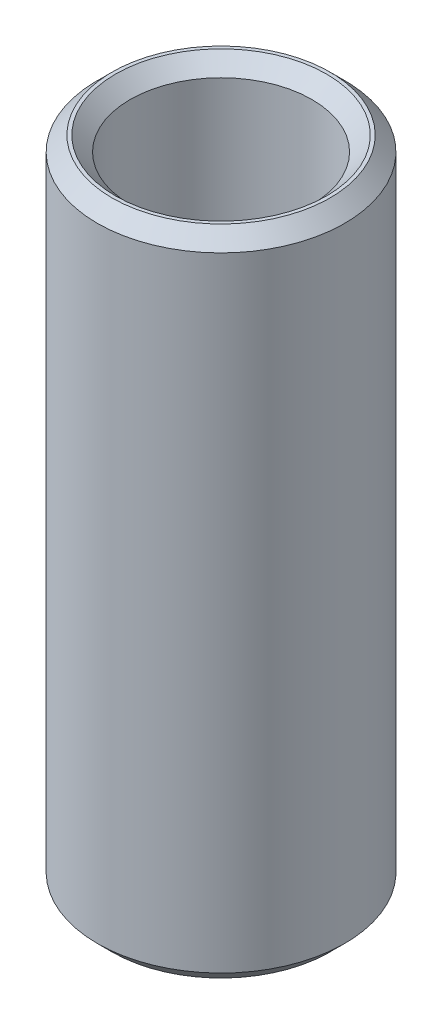
from build123d import *

# Parameters (mm, degrees)
SKETCH1_R           = 10
BOSS_EXTRUDE1_DEPTH = 52.796442174
SKETCH2_R           = 7.348332093
CUT_EXTRUDE1_DEPTH  = 55.657701253
CHAMFER1_SIZE       = 1.185703705


with BuildPart() as part:
    # Sketch1 → Boss-Extrude1 (new body)
    with BuildSketch(Plane(origin=(0, 0, 0), x_dir=(1, 0, 0), z_dir=(0, 1, 0))):
        Circle(SKETCH1_R)
    extrude(amount=BOSS_EXTRUDE1_DEPTH)

    # Sketch2 → Cut-Extrude1 (cut, through all)
    with BuildSketch(Plane(origin=(0, 0, 0), x_dir=(1, 0, 0), z_dir=(0, 1, 0))):
        Circle(SKETCH2_R)
    extrude(amount=CUT_EXTRUDE1_DEPTH, mode=Mode.SUBTRACT)

    # Chamfer1
    chamfer1_edges = [part.edges().sort_by_distance(p)[0] for p in [
        (-7.348332093, 52.796442174, 0),
        (-7.348332093, 0, 0),
        (-10, 0, 0),
        (-10, 52.796442174, 0),
    ]]
    chamfer(chamfer1_edges, length=CHAMFER1_SIZE)


solid = part.part
